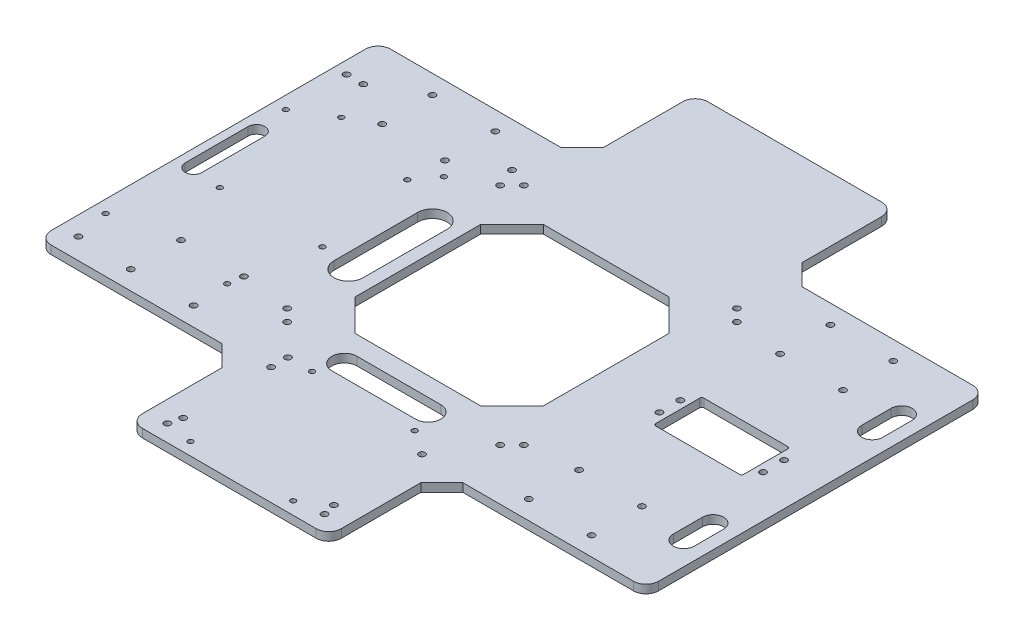
from build123d import *

# Parameters (mm, degrees)
EXTRUDE_1_DEPTH      = 4
SKETCH_2_R           = 1.5
CUT_EXTRUDE_1_DEPTH  = 4
SKETCH_4_W           = 90
SKETCH_4_H           = 90
CUT_EXTRUDE_3_DEPTH  = 4
FILLET_3_R           = 6
CHAMFER_1_SIZE       = 10
CUT_EXTRUDE_6_DEPTH  = 4
CHAMFER_2_SIZE       = 15
SKETCH_8_R           = 1.5
CUT_EXTRUDE_7_DEPTH  = 4
SKETCH_9_R           = 1.5
CUT_EXTRUDE_8_DEPTH  = 4
CUT_EXTRUDE_9_DEPTH  = 10
SKETCH_14_R          = 1.5
SKETCH_14_R_2        = 1.25
CUT_EXTRUDE_10_DEPTH = 10
SKETCH_15_R          = 1.5
SKETCH_15_W          = 42
SKETCH_15_H          = 23
CUT_EXTRUDE_11_DEPTH = 10
FILLET_4_R           = 1
SKETCH_16_R          = 1.25
CUT_EXTRUDE_12_DEPTH = 10
SKETCH_23_R          = 1.25
CUT_EXTRUDE_14_DEPTH = 10
SKETCH_24_R          = 1.5
CUT_EXTRUDE_15_DEPTH = 10
SKETCH_20_R          = 1.5
CUT_EXTRUDE_16_DEPTH = 10


with BuildPart() as part:
    # 草图1 → 凸台-拉伸1 (new body)
    with BuildSketch(Plane(origin=(0, 0, 0), x_dir=(1, 0, 0), z_dir=(0, 1, 0))):
        Polygon((-47.5, -81), (-47.5, -135), (47.5, -135), (47.5, -81), (145, -81), (145, 81), (47.5, 81), (47.5, 135), (-47.5, 135), (-47.5, 81), (-145, 81), (-145, -81), align=None)
    extrude(amount=EXTRUDE_1_DEPTH)

    # 草图2 → 切除-拉伸1 (cut)
    with BuildSketch(Plane(origin=(0, 4, 0), x_dir=(1, 0, 0), z_dir=(0, 1, 0))):
        with Locations((110, 72)):
            Circle(SKETCH_2_R)
        with Locations((80, 72)):
            Circle(SKETCH_2_R)
        with Locations((80, 48)):
            Circle(SKETCH_2_R)
        with Locations((110, 48)):
            Circle(SKETCH_2_R)
        with Locations((110, -48)):
            Circle(SKETCH_2_R)
        with Locations((110, -72)):
            Circle(SKETCH_2_R)
        with Locations((80, -48)):
            Circle(SKETCH_2_R)
        with Locations((80, -72)):
            Circle(SKETCH_2_R)
        with Locations((-80, -72)):
            Circle(SKETCH_2_R)
        with Locations((-80, -48)):
            Circle(SKETCH_2_R)
        with Locations((-110, -72)):
            Circle(SKETCH_2_R)
        with Locations((-110, -48)):
            Circle(SKETCH_2_R)
        with Locations((-110, 48)):
            Circle(SKETCH_2_R)
        with Locations((-80, 48)):
            Circle(SKETCH_2_R)
        with Locations((-80, 72)):
            Circle(SKETCH_2_R)
        with Locations((-110, 72)):
            Circle(SKETCH_2_R)
    extrude(amount=-CUT_EXTRUDE_1_DEPTH, mode=Mode.SUBTRACT)

    # 草图4 → 切除-拉伸3 (cut)
    with BuildSketch(Plane(origin=(0, 4, 0), x_dir=(1, 0, 0), z_dir=(0, 1, 0))):
        Rectangle(SKETCH_4_W, SKETCH_4_H)
    extrude(amount=-CUT_EXTRUDE_3_DEPTH, mode=Mode.SUBTRACT)

    # 圆角3
    fillet_3_edges = [part.edges().sort_by_distance(p)[0] for p in [
        (-47.5, 2, -135),
        (47.5, 2, -135),
        (145, 2, -81),
        (145, 2, 81),
        (-47.5, 2, 135),
        (47.5, 2, 135),
        (-145, 2, 81),
        (-145, 2, -81),
    ]]
    fillet(fillet_3_edges, radius=FILLET_3_R)

    # 倒角1
    chamfer_1_edges = [part.edges().sort_by_distance(p)[0] for p in [
        (47.5, 2, 81),
        (-47.5, 2, 81),
        (47.5, 2, -81),
        (-47.5, 2, -81),
    ]]
    chamfer(chamfer_1_edges, length=CHAMFER_1_SIZE)

    # 草图7 → 切除-拉伸6 (cut)
    with BuildSketch(Plane(origin=(0, 4, 0), x_dir=(1, 0, 0), z_dir=(0, 1, 0))):
        with BuildLine():
            Line((-65, -20), (-65, 20))
            ThreePointArc((-65, 20), (-58, 27), (-51, 20))
            Line((-51, 20), (-51, -20))
            ThreePointArc((-51, -20), (-58, -27), (-65, -20))
        make_face()
        with BuildLine():
            Line((-141, -15), (-141, 15))
            ThreePointArc((-141, 15), (-137, 19), (-133, 15))
            Line((-133, 15), (-133, -15))
            ThreePointArc((-133, -15), (-137, -19), (-141, -15))
        make_face()
        with BuildLine():
            Line((129, 38), (129, 52))
            ThreePointArc((129, 52), (134, 57), (139, 52))
            Line((139, 52), (139, 38))
            ThreePointArc((139, 38), (134, 33), (129, 38))
        make_face()
        with BuildLine():
            Line((129, -38), (129, -52))
            ThreePointArc((129, -52), (134, -57), (139, -52))
            Line((139, -52), (139, -38))
            ThreePointArc((139, -38), (134, -33), (129, -38))
        make_face()
    extrude(amount=-CUT_EXTRUDE_6_DEPTH, mode=Mode.SUBTRACT)

    # 倒角2
    chamfer_2_edges = [part.edges().sort_by_distance(p)[0] for p in [
        (45, 2, 45),
        (-45, 2, 45),
        (45, 2, -45),
        (-45, 2, -45),
    ]]
    chamfer(chamfer_2_edges, length=CHAMFER_2_SIZE)

    # 草图8 → 切除-拉伸7 (cut)
    with BuildSketch(Plane(origin=(0, 4, 0), x_dir=(1, 0, 0), z_dir=(0, 1, 0))):
        with Locations((-139, 60)):
            Circle(SKETCH_8_R)
        with Locations((-131, 60)):
            Circle(SKETCH_8_R)
    extrude(amount=-CUT_EXTRUDE_7_DEPTH, mode=Mode.SUBTRACT)

    # 草图9 → 切除-拉伸8 (cut)
    with BuildSketch(Plane(origin=(0, 4, 0), x_dir=(1, 0, 0), z_dir=(0, 1, 0))):
        with Locations((50.843145751, 56.5)):
            Circle(SKETCH_9_R)
        with Locations((56.5, 50.843145751)):
            Circle(SKETCH_9_R)
        with Locations((56.5, -50.843145751)):
            Circle(SKETCH_9_R)
        with Locations((50.843145751, -56.5)):
            Circle(SKETCH_9_R)
        with Locations((-50.843145751, -56.5)):
            Circle(SKETCH_9_R)
        with Locations((-56.5, -50.843145751)):
            Circle(SKETCH_9_R)
        with Locations((-56.5, 50.843145751)):
            Circle(SKETCH_9_R)
        with Locations((-50.843145751, 56.5)):
            Circle(SKETCH_9_R)
        with Locations((-37.5, -127)):
            Circle(SKETCH_9_R)
        with Locations((37.5, -127)):
            Circle(SKETCH_9_R)
    extrude(amount=-CUT_EXTRUDE_8_DEPTH, mode=Mode.SUBTRACT)

    # 草图12 → 切除-拉伸9 (cut)
    with BuildSketch(Plane(origin=(0, 4, 0), x_dir=(1, 0, 0), z_dir=(0, 1, 0))):
        with BuildLine():
            Line((-20, -54), (20, -54))
            ThreePointArc((20, -54), (26, -60), (20, -66))
            Line((20, -66), (-20, -66))
            ThreePointArc((-20, -66), (-26, -60), (-20, -54))
        make_face()
    extrude(amount=-CUT_EXTRUDE_9_DEPTH, mode=Mode.SUBTRACT)

    # 草图14 → 切除-拉伸10 (cut)
    with BuildSketch(Plane(origin=(0, 4, 0), x_dir=(1, 0, 0), z_dir=(0, 1, 0))):
        with Locations((36, -79)):
            Circle(SKETCH_14_R)
        with Locations((36, -121)):
            Circle(SKETCH_14_R)
        with Locations((-36, -121)):
            Circle(SKETCH_14_R)
        with Locations((-36, -79)):
            Circle(SKETCH_14_R)
        with Locations((-24.5, -71)):
            Circle(SKETCH_14_R_2)
        with Locations((24.5, -71)):
            Circle(SKETCH_14_R_2)
        with Locations((24.5, -129)):
            Circle(SKETCH_14_R_2)
        with Locations((-24.5, -129)):
            Circle(SKETCH_14_R_2)
    extrude(amount=-CUT_EXTRUDE_10_DEPTH, mode=Mode.SUBTRACT)

    # 草图15 → 切除-拉伸11 (cut)
    with BuildSketch(Plane(origin=(0, 4, 0), x_dir=(1, 0, 0), z_dir=(0, 1, 0))):
        with Locations((75.36, 5)):
            Circle(SKETCH_15_R)
        with Locations((75.36, -5)):
            Circle(SKETCH_15_R)
        with Locations((124.86, -5)):
            Circle(SKETCH_15_R)
        with Locations((124.86, 5)):
            Circle(SKETCH_15_R)
        with Locations((100.11, 0)):
            Rectangle(SKETCH_15_W, SKETCH_15_H)
    extrude(amount=-CUT_EXTRUDE_11_DEPTH, mode=Mode.SUBTRACT)

    # 圆角4
    fillet_4_edges = [part.edges().sort_by_distance(p)[0] for p in [
        (79.11, 2, 11.5),
        (121.11, 2, 11.5),
        (121.11, 2, -11.5),
        (79.11, 2, -11.5),
    ]]
    fillet(fillet_4_edges, radius=FILLET_4_R)

    # 草图16 → 切除-拉伸12 (cut)
    with BuildSketch(Plane(origin=(0, 4, 0), x_dir=(1, 0, 0), z_dir=(0, 1, 0))):
        with Locations((-73.5, 41)):
            Circle(SKETCH_16_R)
        with Locations((-122.5, 41)):
            Circle(SKETCH_16_R)
        with Locations((-73.5, -17)):
            Circle(SKETCH_16_R)
        with Locations((-122.5, -17)):
            Circle(SKETCH_16_R)
    extrude(amount=-CUT_EXTRUDE_12_DEPTH, mode=Mode.SUBTRACT)

    # 草图23 → 切除-拉伸14 (cut)
    with BuildSketch(Plane(origin=(0, 4, 0), x_dir=(1, 0, 0), z_dir=(0, 1, 0))):
        with Locations((-81, 31)):
            Circle(SKETCH_23_R)
        with Locations((-139, 31)):
            Circle(SKETCH_23_R)
        with Locations((-81, -55)):
            Circle(SKETCH_23_R)
        with Locations((-139, -55)):
            Circle(SKETCH_23_R)
    extrude(amount=-CUT_EXTRUDE_14_DEPTH, mode=Mode.SUBTRACT)

    # 草图24 → 切除-拉伸15 (cut)
    with BuildSketch(Plane(origin=(0, 4, 0), x_dir=(1, 0, 0), z_dir=(0, 1, 0))):
        with Locations((-136, -71)):
            Circle(SKETCH_24_R)
        with Locations((-36, -71)):
            Circle(SKETCH_24_R)
        with Locations((-36, -121)):
            Circle(SKETCH_24_R)
    extrude(amount=-CUT_EXTRUDE_15_DEPTH, mode=Mode.SUBTRACT)

    # 草图20 → 切除-拉伸16 (cut)
    with BuildSketch(Plane(origin=(0, 4, 0), x_dir=(1, 0, 0), z_dir=(0, 1, 0))):
        with Locations((-60, 60)):
            Circle(SKETCH_20_R)
    extrude(amount=-CUT_EXTRUDE_16_DEPTH, mode=Mode.SUBTRACT)


solid = part.part
